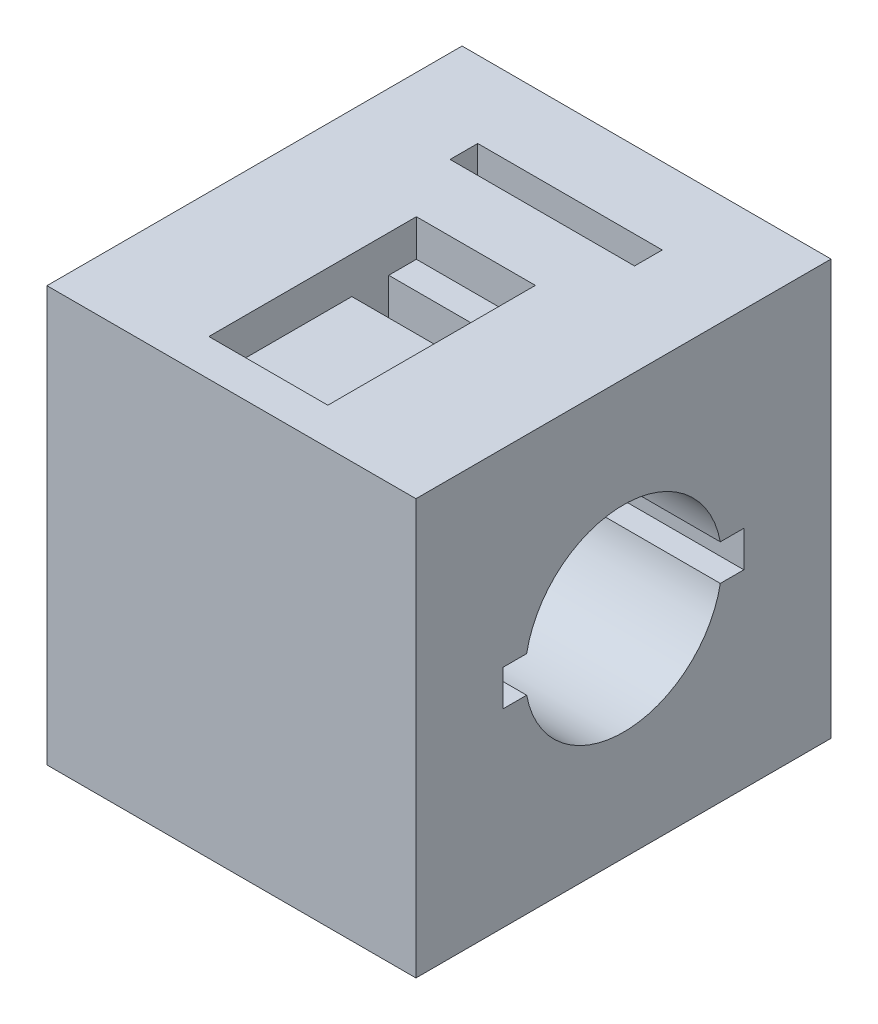
from build123d import *

# Parameters (mm, degrees)
SKETCH1_W           = 45
SKETCH1_H           = 45
BOSS_EXTRUDE1_DEPTH = 40
SKETCH2_R           = 10.675
CUT_EXTRUDE1_DEPTH  = 52.112620751
CUT_EXTRUDE2_DEPTH  = 52.112620751
SKETCH4_W           = 12.9
SKETCH4_H           = 22.5
CUT_EXTRUDE3_DEPTH  = 4
SKETCH5_W           = 12.9
SKETCH5_H           = 4
CUT_EXTRUDE4_DEPTH  = 6
SKETCH6_W           = 20
SKETCH6_H           = 3
CUT_EXTRUDE5_DEPTH  = 6


with BuildPart() as part:
    # Sketch1 → Boss-Extrude1 (new body)
    with BuildSketch(Plane(origin=(0, 0, 0), x_dir=(0, 0, -1), z_dir=(1, 0, 0))):
        Rectangle(SKETCH1_W, SKETCH1_H)
    extrude(amount=BOSS_EXTRUDE1_DEPTH)

    # Sketch2 → Cut-Extrude1 (cut, through all)
    with BuildSketch(Plane(origin=(40, 0, 0), x_dir=(0, 0, -1), z_dir=(1, 0, 0))):
        Circle(SKETCH2_R)
    extrude(amount=-CUT_EXTRUDE1_DEPTH, mode=Mode.SUBTRACT)

    # Sketch3 → Cut-Extrude2 (cut, through all)
    with BuildSketch(Plane(origin=(40, 0, 0), x_dir=(0, 0, -1), z_dir=(1, 0, 0))):
        with BuildLine():
            Line((10.495385891, 1.95), (13.045385891, 1.95))
            Line((13.045385891, 1.95), (13.045385891, -1.95))
            Line((13.045385891, -1.95), (10.495385891, -1.95))
            ThreePointArc((10.495385891, -1.95), (8.545385891, 0), (10.495385891, 1.95))
        make_face()
    cut_extrude2 = extrude(amount=-CUT_EXTRUDE2_DEPTH, mode=Mode.SUBTRACT)

    # Mirror1: Cut-Extrude2 across plane
    add(cut_extrude2.mirror(Plane.XY), mode=Mode.SUBTRACT)

    # Sketch4 → Cut-Extrude3 (cut)
    with BuildSketch(Plane(origin=(0, 22.5, 0), x_dir=(1, 0, 0), z_dir=(0, 1, 0))):
        with Locations((20, -7.25)):
            Rectangle(SKETCH4_W, SKETCH4_H)
    extrude(amount=-CUT_EXTRUDE3_DEPTH, mode=Mode.SUBTRACT)

    # Sketch5 → Cut-Extrude4 (cut)
    with BuildSketch(Plane(origin=(0, 18.5, 0), x_dir=(1, 0, 0), z_dir=(0, 1, 0))):
        with Locations((20, -1)):
            Rectangle(SKETCH5_W, SKETCH5_H)
    extrude(amount=-CUT_EXTRUDE4_DEPTH, mode=Mode.SUBTRACT)

    # Sketch6 → Cut-Extrude5 (cut)
    with BuildSketch(Plane(origin=(0, 22.5, 0), x_dir=(1, 0, 0), z_dir=(0, 1, 0))):
        with Locations((20, 12.7)):
            Rectangle(SKETCH6_W, SKETCH6_H)
    extrude(amount=-CUT_EXTRUDE5_DEPTH, mode=Mode.SUBTRACT)


solid = part.part
